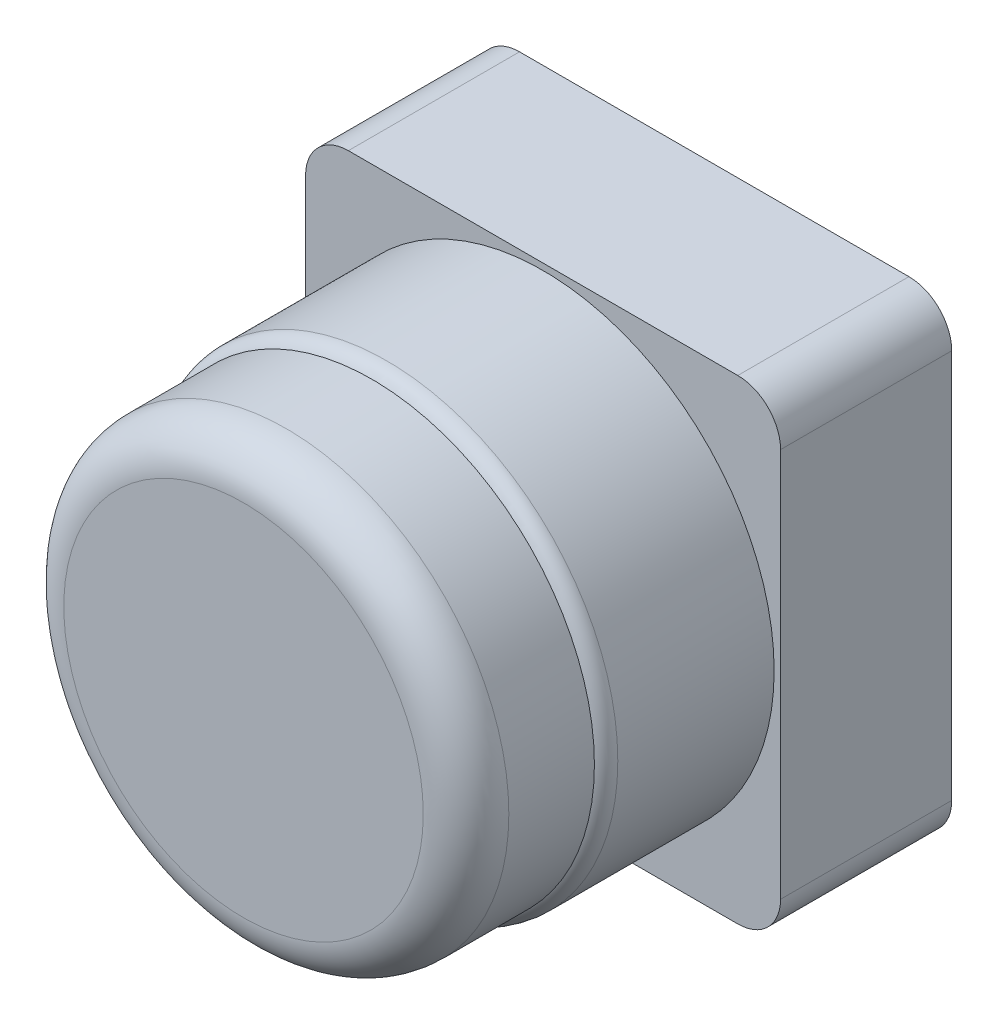
from build123d import *

# Parameters (mm, degrees)
SKETCH_1_W          = 55.5
SKETCH_1_H          = 55.5
EXTRUDE_1_DEPTH     = 20
SKETCH_2_R          = 27
EXTRUDE_3_DEPTH     = 20
SKETCH_3_R          = 26
EXTRUDE_6_DEPTH     = 15
FILLET_1_R          = 5
FILLET_2_R          = 2
FILLET_3_R          = 5
SKETCH_5_R          = 1.5
CUT_EXTRUDE_1_DEPTH = 10
SKETCH_6_W          = 5
SKETCH_6_H          = 4
CUT_EXTRUDE_2_DEPTH = 4


with BuildPart() as part:
    # 草图1 → 凸台-拉伸1 (new body)
    with BuildSketch(Plane.XY):
        Rectangle(SKETCH_1_W, SKETCH_1_H)
    extrude(amount=EXTRUDE_1_DEPTH)

    # 草图2 → 凸台-拉伸3 (add)
    with BuildSketch(Plane.XY.offset(20)):
        Circle(SKETCH_2_R)
    extrude(amount=EXTRUDE_3_DEPTH)

    # 草图3 → 凸台-拉伸6 (add)
    with BuildSketch(Plane.XY.offset(40)):
        Circle(SKETCH_3_R)
    extrude(amount=EXTRUDE_6_DEPTH)

    # 圆角1
    fillet_1_edges = [part.edges().sort_by_distance(p)[0] for p in [
        (-26, 0, 55),
    ]]
    fillet(fillet_1_edges, radius=FILLET_1_R)

    # 圆角2
    # the kernel refuses this fillet: 2 mm, written as the material it takes off along each edge
    with BuildSketch(Plane(origin=(0, 0, 40), x_dir=(1, 0, 0), z_dir=(0, -1, 0))) as fillet_2_piece_1:
        with BuildLine():
            CenterArc((25, -1.732050808), FILLET_2_R, 0, 60)
            Line((27, -1.732050808), (27.04, -1.732050808))
            Line((27.04, -1.732050808), (27.04, 0))
            Line((27.04, 0), (27, 0.04))
            ThreePointArc((27, 0.04), (26.5, 0.04), (26.02, 0.034641016))
            Line((26.02, 0.034641016), (26, 0))
        make_face()
    revolve(axis=Axis((0, 0, 40), (0, 0, 1)), mode=Mode.SUBTRACT)

    # 圆角3
    fillet_3_edges = [part.edges().sort_by_distance(p)[0] for p in [
        (-27.75, 27.75, 10),
        (27.75, 27.75, 10),
        (27.75, -27.75, 10),
        (-27.75, -27.75, 10),
    ]]
    fillet(fillet_3_edges, radius=FILLET_3_R)

    # 草图5 → 切除-拉伸1 (cut)
    with BuildSketch(Plane(origin=(0, 0, 0), x_dir=(-1, 0, 0), z_dir=(0, 0, -1))):
        Circle(SKETCH_5_R)
        with Locations((-21.75, 21.75)):
            Circle(SKETCH_5_R)
        with Locations(Location((21.75, 21.75, 0), (0, 0, 180))):
            Circle(SKETCH_5_R)
        with Locations((21.75, -21.75)):
            Circle(SKETCH_5_R)
        with Locations(Location((-21.75, -21.75, 0), (0, 0, 180))):
            Circle(SKETCH_5_R)
    extrude(amount=-CUT_EXTRUDE_1_DEPTH, mode=Mode.SUBTRACT)

    # 草图6 → 切除-拉伸2 (cut)
    with BuildSketch(Plane.XZ.offset(27.75)):
        with Locations((-2.5, 3)):
            Rectangle(SKETCH_6_W, SKETCH_6_H)
        with Locations((2.5, 3)):
            Rectangle(SKETCH_6_W, SKETCH_6_H)
    extrude(amount=-CUT_EXTRUDE_2_DEPTH, mode=Mode.SUBTRACT)


solid = part.part
